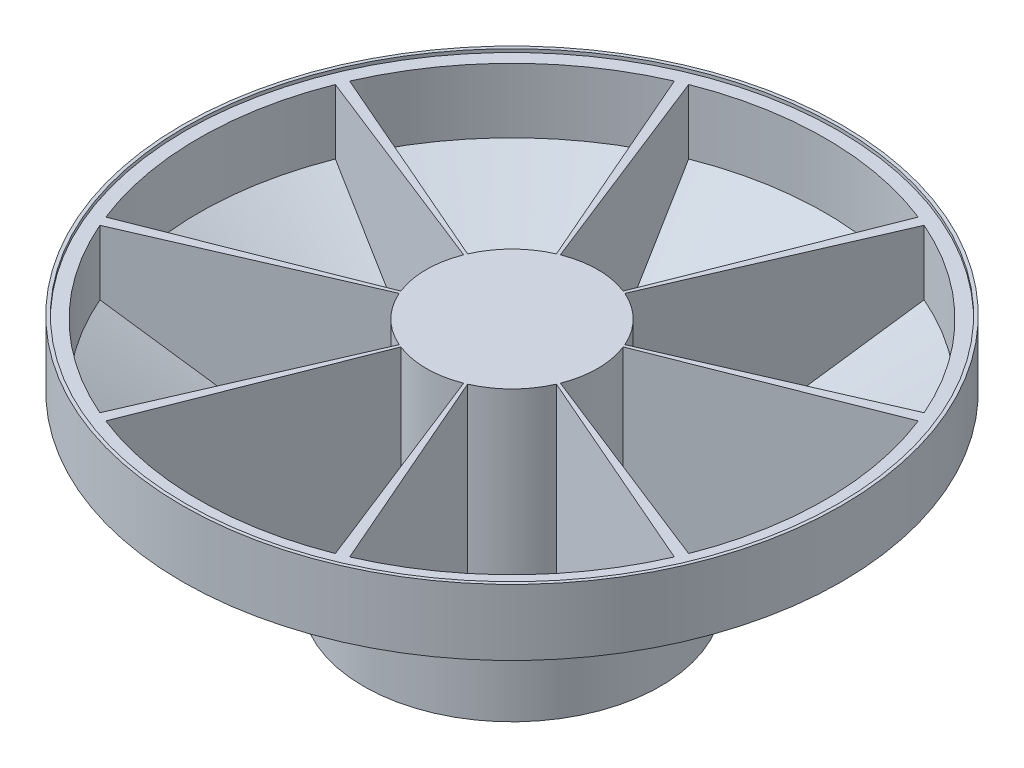
from build123d import *

# Parameters (mm, degrees)
SKETCH4_R          = 99
CUT_EXTRUDE1_DEPTH = 1
CUT_EXTRUDE2_START = -74
CUT_EXTRUDE2_DEPTH = 74
CUT_EXTRUDE3_REACH = 161.612
CIRPATTERN1_COUNT  = 8


# Read off the part's stored shape, not the designer's step: Cut-Extrude2
with BuildPart() as part:
    # Sketch1 → Revolve1 (revolve)
    with BuildSketch(Plane.XY, mode=Mode.PRIVATE) as revolve1_sk:
        Polygon((0, 0), (-100, 0), (-100, -20), (-45, -51.754264805), (-45, -75), (-25, -75), (-25, -2), (0, -2), align=None)
    revolve(revolve1_sk.sketch.rotate(Axis((0, 0, 0), (0, 1, 0)), 270), axis=Axis((0, 0, 0), (0, 1, 0)))

    # Sketch4 → Cut-Extrude1 (cut)
    with BuildSketch(Plane(origin=(0, 0, 0), x_dir=(1, 0, 0), z_dir=(0, 1, 0))):
        with Locations(Location((0, 0, 0), (0, 0, 270))):
            Circle(SKETCH4_R)
    extrude(amount=-CUT_EXTRUDE1_DEPTH, mode=Mode.SUBTRACT)

    # Cut-Extrude2 outline → Cut-Extrude2 (cut)
    with BuildSketch(Plane(origin=(0, -1, 0), x_dir=(1, 0, 0), z_dir=(0, 1, 0)).offset(CUT_EXTRUDE2_START)):
        with BuildLine():
            ThreePointArc((-24.190856768, -9.529031895), (-26, 0), (-24.190856768, 9.529031895))
            Line((-24.190856768, 9.529031895), (-40.938372991, 16.126053976))
            ThreePointArc((-40.938372991, 16.126053976), (-44, 0), (-40.938372991, -16.126053976))
            Line((-40.938372991, -16.126053976), (-24.190856768, -9.529031895))
        make_face()
    cut_extrude2 = extrude(amount=CUT_EXTRUDE2_DEPTH, mode=Mode.SUBTRACT)

    # Cut-Extrude3: up to this cone (the profile starts inside it)
    cut_extrude3_end = Plane(origin=(0, -1, 0), z_dir=(0, 1, 0)).offset(-74.425624842) * Cone(1.732e-06, 632.972063387, 365.446590186, align=(Align.CENTER, Align.CENTER, Align.MIN), mode=Mode.PRIVATE)
    # Sketch5<4> → Cut-Extrude3 (cut, up to the surface)
    with BuildSketch(Plane(origin=(0, -1, 0), x_dir=(1, 0, 0), z_dir=(0, 1, 0)), mode=Mode.PRIVATE) as cut_extrude3_sk1:
        with BuildLine():
            Line((-88.389668958, -34.817616539), (-24.190856768, -9.529031895))
            ThreePointArc((-24.190856768, -9.529031895), (-26, 0), (-24.190856768, 9.529031895))
            Line((-24.190856768, 9.529031895), (-88.389668958, 34.817616539))
            ThreePointArc((-88.389668958, 34.817616539), (-95, 0), (-88.389668958, -34.817616539))
        make_face()
    cut_extrude3_tool1 = extrude(cut_extrude3_sk1.sketch, amount=-CUT_EXTRUDE3_REACH, mode=Mode.PRIVATE) & cut_extrude3_end
    cut_extrude3 = cut_extrude3_tool1.solids().sort_by_distance((-65.495165, -1, 0))[0]
    add(cut_extrude3, mode=Mode.SUBTRACT)

    # CirPattern1: Cut-Extrude2, Cut-Extrude3 ×8 about axis
    cirpattern1_axis = Axis((0, 0, 0), (0, 1, 0))
    add([cut_extrude2.rotate(cirpattern1_axis, i * 360 / CIRPATTERN1_COUNT) for i in range(1, CIRPATTERN1_COUNT)], mode=Mode.SUBTRACT)
    add([cut_extrude3.rotate(cirpattern1_axis, i * 360 / CIRPATTERN1_COUNT) for i in range(1, CIRPATTERN1_COUNT)], mode=Mode.SUBTRACT)


solid = part.part
